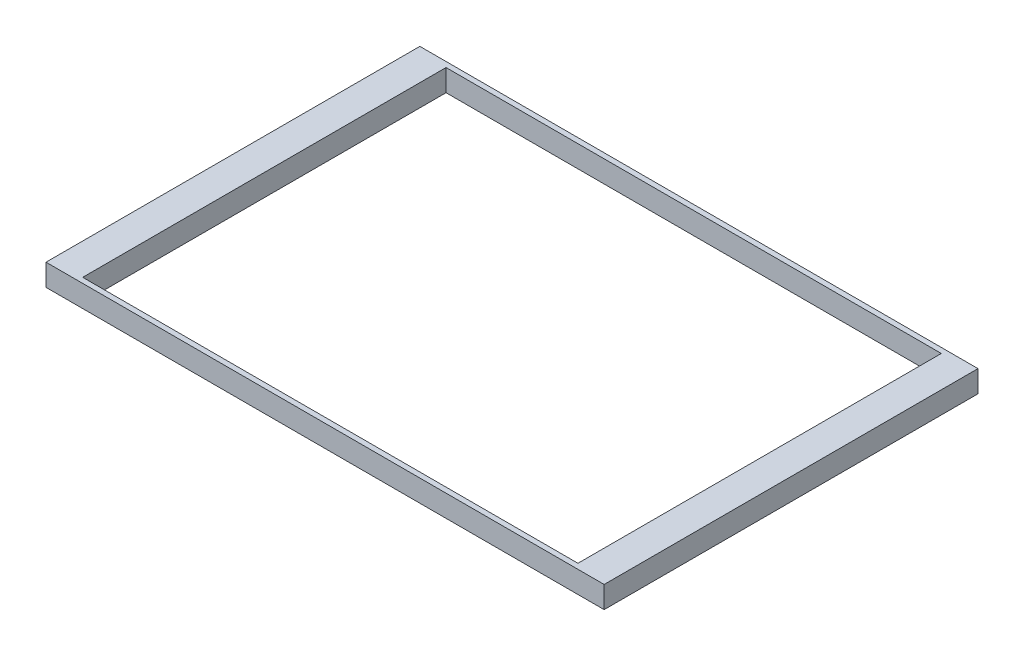
from build123d import *

# Parameters (mm, degrees)
SKETCH1_W           = 127.8
SKETCH1_H           = 85.6
BOSS_EXTRUDE1_DEPTH = 5
SKETCH2_W           = 113.4
SKETCH2_H           = 83.2
CUT_EXTRUDE1_DEPTH  = 5


with BuildPart() as part:
    # Sketch1 → Boss-Extrude1 (new body)
    with BuildSketch(Plane(origin=(0, 0, 0), x_dir=(1, 0, 0), z_dir=(0, 1, 0))):
        Rectangle(SKETCH1_W, SKETCH1_H)
    extrude(amount=BOSS_EXTRUDE1_DEPTH)

    # Sketch2 → Cut-Extrude1 (cut)
    with BuildSketch(Plane(origin=(0, 5, 0), x_dir=(1, 0, 0), z_dir=(0, 1, 0))):
        Rectangle(SKETCH2_W, SKETCH2_H)
    extrude(amount=-CUT_EXTRUDE1_DEPTH, mode=Mode.SUBTRACT)


solid = part.part
